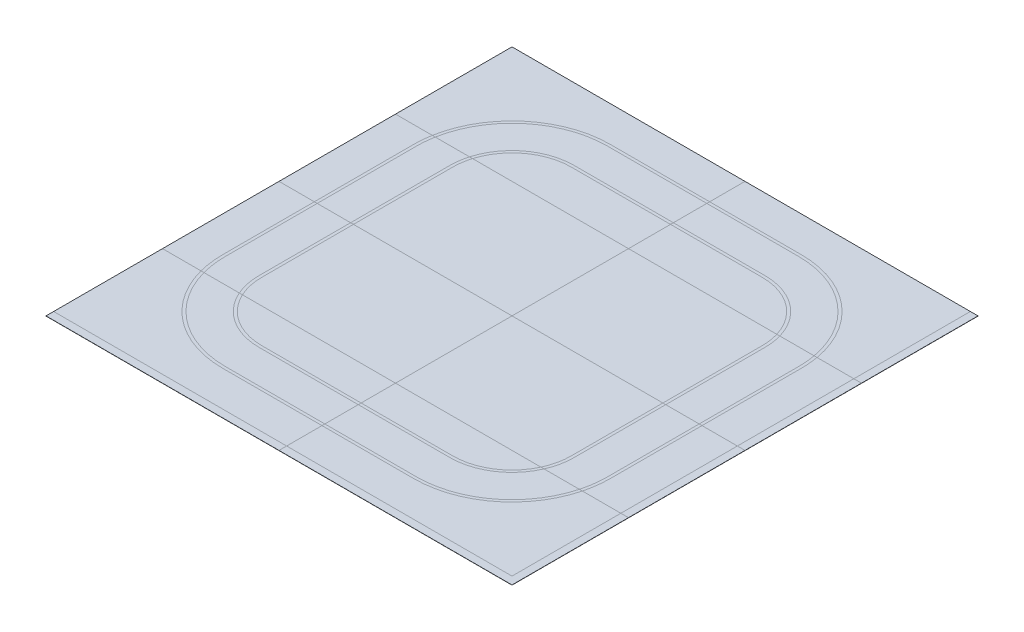
from build123d import *

# Parameters (mm, degrees)
SKETCH1_W           = 4880
SKETCH1_H           = 4880
BOSS_EXTRUDE1_DEPTH = 2
SPLIT1_START        = -1220
SPLIT1_OUTLINE_W    = 4880
SPLIT1_OUTLINE_H    = 2
SPLIT1_DEPTH        = 3660
SPLIT1_START_2      = -2440
SPLIT1_2_OUTLINE_W  = 2440
SPLIT1_2_OUTLINE_H  = 2
SPLIT1_2_DEPTH      = 1220
SPLIT1_START_3      = 1220
SPLIT1_3_OUTLINE_W  = 2440
SPLIT1_3_OUTLINE_H  = 2
SPLIT1_3_DEPTH      = 1220
SPLIT1_4_OUTLINE_W  = 2
SPLIT1_4_OUTLINE_H  = 1220
SPLIT1_4_DEPTH      = 2440
SPLIT1_5_OUTLINE_W  = 2440
SPLIT1_5_OUTLINE_H  = 2
SPLIT1_5_DEPTH      = 1220
SPLIT1_6_OUTLINE_W  = 2440
SPLIT1_6_OUTLINE_H  = 2
SPLIT1_6_DEPTH      = 1220
SPLIT1_7_OUTLINE_W  = 2440
SPLIT1_7_OUTLINE_H  = 2
SPLIT1_7_DEPTH      = 1220
SPLIT1_8_OUTLINE_W  = 2
SPLIT1_8_OUTLINE_H  = 1220
SPLIT1_8_DEPTH      = 2440
SPLIT1_9_OUTLINE_W  = 2440
SPLIT1_9_OUTLINE_H  = 2
SPLIT1_9_DEPTH      = 1220


# Read off the part's stored shape, not the designer's step: Split1
with BuildPart() as part:
    # Sketch1 → Boss-Extrude1 (new body)
    with BuildSketch(Plane(origin=(0, 0, 0), x_dir=(1, 0, 0), z_dir=(0, 1, 0))):
        Rectangle(SKETCH1_W, SKETCH1_H)
    extrude(amount=BOSS_EXTRUDE1_DEPTH)

    # Split1 outline → Split1 (cut)
    with BuildSketch(Plane.XY.offset(SPLIT1_START)):
        with Locations((0, 1)):
            Rectangle(SPLIT1_OUTLINE_W, SPLIT1_OUTLINE_H)
    extrude(amount=SPLIT1_DEPTH, mode=Mode.SUBTRACT)

    # Split1 2 outline → Split1 2 (cut)
    with BuildSketch(Plane.XY.offset(SPLIT1_START_2)):
        with Locations((1220, 1)):
            Rectangle(SPLIT1_2_OUTLINE_W, SPLIT1_2_OUTLINE_H)
    extrude(amount=SPLIT1_2_DEPTH, mode=Mode.SUBTRACT)


with BuildPart() as body_2:
    # Split1 3 outline → Split1 3 (new body)
    with BuildSketch(Plane.XY.offset(SPLIT1_START_3)):
        with Locations((-1220, 1)):
            Rectangle(SPLIT1_3_OUTLINE_W, SPLIT1_3_OUTLINE_H)
    extrude(amount=SPLIT1_3_DEPTH)


with BuildPart() as body_3:
    # Split1 4 outline → Split1 4 (new body)
    with BuildSketch(Plane.YZ):
        with Locations((1, 1830)):
            Rectangle(SPLIT1_4_OUTLINE_W, SPLIT1_4_OUTLINE_H)
    extrude(amount=SPLIT1_4_DEPTH)


with BuildPart() as body_4:
    # Split1 5 outline → Split1 5 (new body)
    with BuildSketch(Plane.XY.offset(SPLIT1_START)):
        with Locations((1220, 1)):
            Rectangle(SPLIT1_5_OUTLINE_W, SPLIT1_5_OUTLINE_H)
    extrude(amount=SPLIT1_5_DEPTH)


with BuildPart() as body_5:
    # Split1 6 outline → Split1 6 (new body)
    with BuildSketch(Plane.XY):
        with Locations((-1220, 1)):
            Rectangle(SPLIT1_6_OUTLINE_W, SPLIT1_6_OUTLINE_H)
    extrude(amount=SPLIT1_6_DEPTH)


with BuildPart() as body_6:
    # Split1 7 outline → Split1 7 (new body)
    with BuildSketch(Plane.XY):
        with Locations((1220, 1)):
            Rectangle(SPLIT1_7_OUTLINE_W, SPLIT1_7_OUTLINE_H)
    extrude(amount=SPLIT1_7_DEPTH)


with BuildPart() as body_7:
    # Split1 8 outline → Split1 8 (new body)
    with BuildSketch(Plane.YZ):
        with Locations((1, -1830)):
            Rectangle(SPLIT1_8_OUTLINE_W, SPLIT1_8_OUTLINE_H)
    extrude(amount=SPLIT1_8_DEPTH)


with BuildPart() as body_8:
    # Split1 9 outline → Split1 9 (new body)
    with BuildSketch(Plane.XY.offset(SPLIT1_START)):
        with Locations((-1220, 1)):
            Rectangle(SPLIT1_9_OUTLINE_W, SPLIT1_9_OUTLINE_H)
    extrude(amount=SPLIT1_9_DEPTH)


solid = Compound([part.part, body_2.part, body_3.part, body_4.part, body_5.part, body_6.part, body_7.part, body_8.part])
